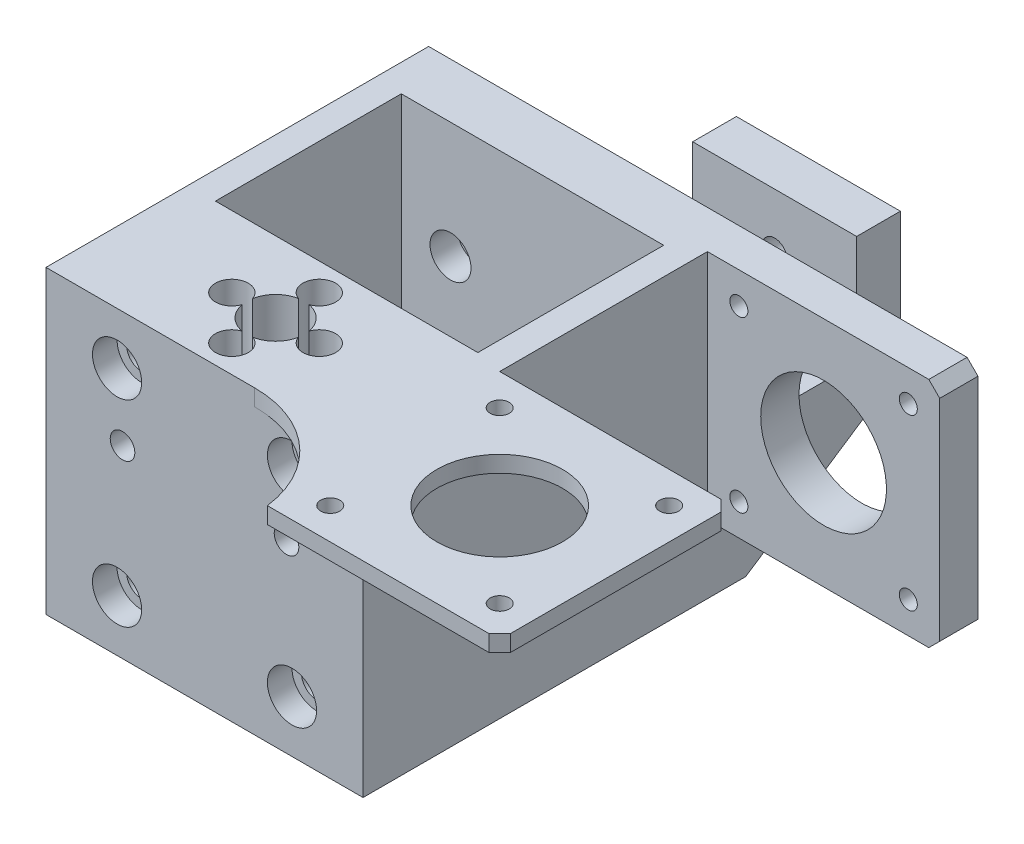
from build123d import *

# Parameters (mm, degrees)
SKETCH1_W           = 48
SKETCH1_H           = 26
SKETCH1_R           = 5.25
BOSS_EXTRUDE1_DEPTH = 55
CUT_EXTRUDE1_REACH  = 67.399
SKETCH2_R           = 2.75
SKETCH3_R           = 4.5
CUT_EXTRUDE2_DEPTH  = 4.5
CUT_EXTRUDE3_REACH  = 63.4
SKETCH4_R           = 1.75
SKETCH5_R           = 3
CUT_EXTRUDE4_DEPTH  = 15
SKETCH6_R           = 11.25
CUT_EXTRUDE5_DEPTH  = 30
BOSS_EXTRUDE3_DEPTH = 55
SKETCH10_W          = 42.5
SKETCH10_H          = 42.5
SKETCH10_R          = 1.65
SKETCH10_R_2        = 11.5
BOSS_EXTRUDE4_DEPTH = 7
CHAMFER1_SIZE       = 2
SKETCH11_W          = 42.5
SKETCH11_H          = 42.5
SKETCH11_R          = 11.5
SKETCH11_R_2        = 1.75
BOSS_EXTRUDE5_DEPTH = 3
FILLET2_R           = 20
CHAMFER2_SIZE       = 2
BOSS_EXTRUDE6_DEPTH = 58
SKETCH13_R          = 2.25
CUT_EXTRUDE6_DEPTH  = 126.672192628
SKETCH14_R          = 3.75
CUT_EXTRUDE7_DEPTH  = 5
SKETCH15_R          = 2.25
CUT_EXTRUDE8_DEPTH  = 8
SKETCH16_R          = 3.75
CUT_EXTRUDE9_DEPTH  = 1
SKETCH17_R          = 3
CUT_EXTRUDE10_DEPTH = 2


with BuildPart() as part:
    # Sketch1 → Boss-Extrude1 (new body)
    with BuildSketch(Plane(origin=(0, 0, 0), x_dir=(1, 0, 0), z_dir=(0, 1, 0))):
        Rectangle(SKETCH1_W, SKETCH1_H)
        with Locations(Location((0, 0, 0), (0, 0, 270))):
            Circle(SKETCH1_R, mode=Mode.SUBTRACT)
    extrude(amount=BOSS_EXTRUDE1_DEPTH)

    # Sketch2 → Cut-Extrude1 (cut, up to next)
    with BuildSketch(Plane.XY.offset(13), mode=Mode.PRIVATE) as cut_extrude1_sk1:
        with Locations((-16, 45.5)):
            Circle(SKETCH2_R)
    cut_extrude1_tool1 = extrude(cut_extrude1_sk1.sketch, amount=-CUT_EXTRUDE1_REACH, mode=Mode.PRIVATE) & part.part
    # Sketch2 → Cut-Extrude1 (cut, up to next)
    with BuildSketch(Plane.XY.offset(13), mode=Mode.PRIVATE) as cut_extrude1_sk2:
        with Locations((16, 45.5)):
            Circle(SKETCH2_R)
    cut_extrude1_tool2 = extrude(cut_extrude1_sk2.sketch, amount=-CUT_EXTRUDE1_REACH, mode=Mode.PRIVATE) & part.part
    # Sketch2 → Cut-Extrude1 (cut, up to next)
    with BuildSketch(Plane.XY.offset(13), mode=Mode.PRIVATE) as cut_extrude1_sk3:
        with Locations((16, 9.5)):
            Circle(SKETCH2_R)
    cut_extrude1_tool3 = extrude(cut_extrude1_sk3.sketch, amount=-CUT_EXTRUDE1_REACH, mode=Mode.PRIVATE) & part.part
    # Sketch2 → Cut-Extrude1 (cut, up to next)
    with BuildSketch(Plane.XY.offset(13), mode=Mode.PRIVATE) as cut_extrude1_sk4:
        with Locations((-16, 9.5)):
            Circle(SKETCH2_R)
    cut_extrude1_tool4 = extrude(cut_extrude1_sk4.sketch, amount=-CUT_EXTRUDE1_REACH, mode=Mode.PRIVATE) & part.part
    add(cut_extrude1_tool1.solids().sort_by_distance((-16, 45.5, 13))[0], mode=Mode.SUBTRACT)
    add(cut_extrude1_tool2.solids().sort_by_distance((16, 45.5, 13))[0], mode=Mode.SUBTRACT)
    add(cut_extrude1_tool3.solids().sort_by_distance((16, 9.5, 13))[0], mode=Mode.SUBTRACT)
    add(cut_extrude1_tool4.solids().sort_by_distance((-16, 9.5, 13))[0], mode=Mode.SUBTRACT)

    # Sketch3 → Cut-Extrude2 (cut)
    with BuildSketch(Plane.XY.offset(13)):
        with Locations((-16, 45.5)):
            Circle(SKETCH3_R)
        with Locations(Location((16, 45.5, 0), (0, 0, 180))):
            Circle(SKETCH3_R)
        with Locations((16, 9.5)):
            Circle(SKETCH3_R)
        with Locations(Location((-16, 9.5, 0), (0, 0, 180))):
            Circle(SKETCH3_R)
    extrude(amount=-CUT_EXTRUDE2_DEPTH, mode=Mode.SUBTRACT)

    # Sketch4 → Cut-Extrude3 (cut, up to next)
    with BuildSketch(Plane(origin=(0, 55, 0), x_dir=(1, 0, 0), z_dir=(0, 1, 0)), mode=Mode.PRIVATE) as cut_extrude3_sk1:
        with Locations(Location((0, 8, 0), (0, 0, 270))):
            Circle(SKETCH4_R)
    cut_extrude3_tool1 = extrude(cut_extrude3_sk1.sketch, amount=-CUT_EXTRUDE3_REACH, mode=Mode.PRIVATE) & part.part
    # Sketch4 → Cut-Extrude3 (cut, up to next)
    with BuildSketch(Plane(origin=(0, 55, 0), x_dir=(1, 0, 0), z_dir=(0, 1, 0)), mode=Mode.PRIVATE) as cut_extrude3_sk2:
        with Locations(Location((8, 0, 0), (0, 0, 270))):
            Circle(SKETCH4_R)
    cut_extrude3_tool2 = extrude(cut_extrude3_sk2.sketch, amount=-CUT_EXTRUDE3_REACH, mode=Mode.PRIVATE) & part.part
    # Sketch4 → Cut-Extrude3 (cut, up to next)
    with BuildSketch(Plane(origin=(0, 55, 0), x_dir=(1, 0, 0), z_dir=(0, 1, 0)), mode=Mode.PRIVATE) as cut_extrude3_sk3:
        with Locations(Location((0, -8, 0), (0, 0, 270))):
            Circle(SKETCH4_R)
    cut_extrude3_tool3 = extrude(cut_extrude3_sk3.sketch, amount=-CUT_EXTRUDE3_REACH, mode=Mode.PRIVATE) & part.part
    # Sketch4 → Cut-Extrude3 (cut, up to next)
    with BuildSketch(Plane(origin=(0, 55, 0), x_dir=(1, 0, 0), z_dir=(0, 1, 0)), mode=Mode.PRIVATE) as cut_extrude3_sk4:
        with Locations(Location((-8, 0, 0), (0, 0, 270))):
            Circle(SKETCH4_R)
    cut_extrude3_tool4 = extrude(cut_extrude3_sk4.sketch, amount=-CUT_EXTRUDE3_REACH, mode=Mode.PRIVATE) & part.part
    add(cut_extrude3_tool1.solids().sort_by_distance((0, 55, -8))[0], mode=Mode.SUBTRACT)
    add(cut_extrude3_tool2.solids().sort_by_distance((8, 55, 0))[0], mode=Mode.SUBTRACT)
    add(cut_extrude3_tool3.solids().sort_by_distance((0, 55, 8))[0], mode=Mode.SUBTRACT)
    add(cut_extrude3_tool4.solids().sort_by_distance((-8, 55, 0))[0], mode=Mode.SUBTRACT)

    # Sketch5 → Cut-Extrude4 (cut)
    with BuildSketch(Plane(origin=(0, 55, 0), x_dir=(1, 0, 0), z_dir=(0, 1, 0))):
        with Locations((0, 8)):
            Circle(SKETCH5_R)
        with Locations((8, 0)):
            Circle(SKETCH5_R)
        with Locations((0, -8)):
            Circle(SKETCH5_R)
        with Locations((-8, 0)):
            Circle(SKETCH5_R)
    extrude(amount=-CUT_EXTRUDE4_DEPTH, mode=Mode.SUBTRACT)

    # Sketch6 → Cut-Extrude5 (cut)
    with BuildSketch(Plane.XZ):
        with Locations(Location((0, 0, 0), (0, 0, 270))):
            Circle(SKETCH6_R)
    extrude(amount=-CUT_EXTRUDE5_DEPTH, mode=Mode.SUBTRACT)

    # Sketch9 → Boss-Extrude3 (add)
    with BuildSketch(Plane(origin=(0, 55, 0), x_dir=(1, 0, 0), z_dir=(0, 1, 0))):
        Polygon((-24, -13), (-29, -13), (-29, 57), (29, 57), (29, -13), (24, -13), (24, 47), (-24, 47), align=None)
    extrude(amount=-BOSS_EXTRUDE3_DEPTH)

    # Sketch10 → Boss-Extrude4 (add)
    with BuildSketch(Plane(origin=(0, 0, -57), x_dir=(-1, 0, 0), z_dir=(0, 0, -1))):
        with Locations((-50.25, 33.75)):
            Rectangle(SKETCH10_W, SKETCH10_H)
        with Locations((-65.75, 49.25)):
            Circle(SKETCH10_R, mode=Mode.SUBTRACT)
        with Locations(Location((-34.75, 49.25, 0), (0, 0, 180))):
            Circle(SKETCH10_R, mode=Mode.SUBTRACT)
        with Locations((-34.75, 18.25)):
            Circle(SKETCH10_R, mode=Mode.SUBTRACT)
        with Locations(Location((-65.75, 18.25, 0), (0, 0, 180))):
            Circle(SKETCH10_R, mode=Mode.SUBTRACT)
        with Locations((-50.25, 33.75)):
            Circle(SKETCH10_R_2, mode=Mode.SUBTRACT)
    extrude(amount=-BOSS_EXTRUDE4_DEPTH)

    # Chamfer1
    chamfer1_edges = [part.edges().sort_by_distance(p)[0] for p in [
        (71.5, 12.5, -53.5),
        (71.5, 55, -53.5),
    ]]
    chamfer(chamfer1_edges, length=CHAMFER1_SIZE)

    # Sketch11 → Boss-Extrude5 (add)
    with BuildSketch(Plane(origin=(0, 55, 0), x_dir=(1, 0, 0), z_dir=(0, 1, 0))):
        with Locations((50.25, -9.25)):
            Rectangle(SKETCH11_W, SKETCH11_H)
        with Locations(Location((50.25, -9.25, 0), (0, 0, 270))):
            Circle(SKETCH11_R, mode=Mode.SUBTRACT)
        with Locations(Location((34.75, 6.25, 0), (0, 0, 270))):
            Circle(SKETCH11_R_2, mode=Mode.SUBTRACT)
        with Locations(Location((65.75, 6.25, 0), (0, 0, 90))):
            Circle(SKETCH11_R_2, mode=Mode.SUBTRACT)
        with Locations(Location((65.75, -24.75, 0), (0, 0, 270))):
            Circle(SKETCH11_R_2, mode=Mode.SUBTRACT)
        with Locations(Location((34.75, -24.75, 0), (0, 0, 90))):
            Circle(SKETCH11_R_2, mode=Mode.SUBTRACT)
    extrude(amount=-BOSS_EXTRUDE5_DEPTH)

    # Fillet2
    # the kernel refuses this fillet: 20 mm, written as the material it adds along each edge
    with BuildSketch(Plane(origin=(29, 55, 13), x_dir=(-1, 0, 0), z_dir=(0, -1, 0))) as fillet2_piece_1:
        with BuildLine():
            CenterArc((19.843134833, -20), FILLET2_R, 90, 82.819244219)
            Line((0, -17.5), (0, 0))
            Line((0, 0), (19.843134833, 0))
        make_face()
    extrude(amount=3)

    # Chamfer2
    chamfer2_edges = [part.edges().sort_by_distance(p)[0] for p in [
        (71.5, 53.5, -12),
        (71.5, 53.5, 30.5),
    ]]
    chamfer(chamfer2_edges, length=CHAMFER2_SIZE)

    # Sketch12 → Boss-Extrude6 (add)
    with BuildSketch(Plane(origin=(29, 0, 0), x_dir=(0, 0, -1), z_dir=(1, 0, 0))):
        Polygon((57, 0), (85.3, 18.75), (85.3, 23.75), (85.3, 43.75), (77.3, 43.75), (77.3, 23.75), (57, 23.75), align=None)
    extrude(amount=-BOSS_EXTRUDE6_DEPTH)

    # Sketch13 → Cut-Extrude6 (cut, through all)
    with BuildSketch(Plane(origin=(0, 0, -57), x_dir=(-1, 0, 0), z_dir=(0, 0, -1))):
        with Locations((15, 33.75)):
            Circle(SKETCH13_R)
        with Locations((-15, 33.75)):
            Circle(SKETCH13_R)
    extrude(amount=-CUT_EXTRUDE6_DEPTH, mode=Mode.SUBTRACT)

    # Sketch14 → Cut-Extrude7 (cut)
    with BuildSketch(Plane.XY.offset(-47)):
        with Locations((-15, 33.75)):
            Circle(SKETCH14_R)
        with Locations((15, 33.75)):
            Circle(SKETCH14_R)
    extrude(amount=-CUT_EXTRUDE7_DEPTH, mode=Mode.SUBTRACT)

    # Sketch15 → Cut-Extrude8 (cut)
    with BuildSketch(Plane(origin=(0, 0, -85.3), x_dir=(-1, 0, 0), z_dir=(0, 0, -1))):
        with Locations((-14, 33.75)):
            Circle(SKETCH15_R)
        Polygon((29, 43.75), (1, 43.75), (1, 23.75), (1, 11.75), (29, 11.75), (29, 23.75), align=None)
    extrude(amount=-CUT_EXTRUDE8_DEPTH, mode=Mode.SUBTRACT)

    # Sketch16 → Cut-Extrude9 (cut)
    with BuildSketch(Plane(origin=(0, 0, -85.3), x_dir=(-1, 0, 0), z_dir=(0, 0, -1))):
        with Locations((-14, 33.75)):
            Circle(SKETCH16_R)
    extrude(amount=-CUT_EXTRUDE9_DEPTH, mode=Mode.SUBTRACT)

    # Sketch17 → Cut-Extrude10 (cut)
    with BuildSketch(Plane(origin=(0, 0, -57), x_dir=(-1, 0, 0), z_dir=(0, 0, -1))):
        with Locations((-65.75, 49.25)):
            Circle(SKETCH17_R)
        with Locations(Location((-34.75, 49.25, 0), (0, 0, 180))):
            Circle(SKETCH17_R)
        with Locations((-34.75, 18.25)):
            Circle(SKETCH17_R)
        with Locations(Location((-65.75, 18.25, 0), (0, 0, 180))):
            Circle(SKETCH17_R)
    extrude(amount=-CUT_EXTRUDE10_DEPTH, mode=Mode.SUBTRACT)


solid = part.part
